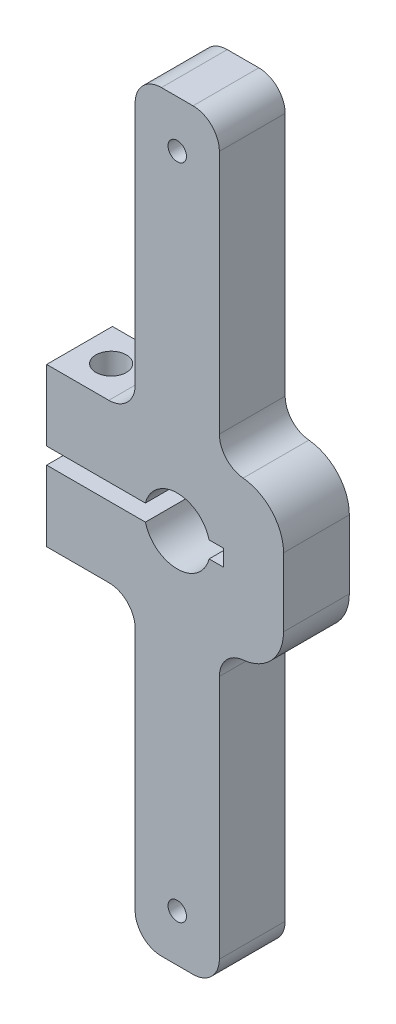
from build123d import *

# Parameters (mm, degrees)
EXTRUDE1_DEPTH              = 6.35
SKETCH2_W                   = 17.047492734
SKETCH2_H                   = 1.5875
EXTRUDE2_DEPTH              = 24.670955704
SKETCH4_R                   = 3.175
EXTRUDE4_DEPTH              = 24.670955704
FILLET2_R                   = 4.318
F_32_0_116_DIAMETER_HOLE1_D = 2.9464
EXTRUDE8_DEPTH              = 28.6766
FILLET1_R                   = 2.54


with BuildPart() as part:
    # Sketch1 → Extrude1 (new body)
    with BuildSketch(Plane.XY):
        Polygon((-21.492492734, 7.62), (-6.252492734, 7.62), (1.367507266, 7.62), (1.367507266, 0), (1.367507266, -7.62), (-6.252492734, -7.62), (-21.492492734, -7.62), align=None)
    extrude(amount=EXTRUDE1_DEPTH)

    # Sketch2 → Extrude2 (cut, through all)
    with BuildSketch(Plane.XY.offset(6.35)):
        with Locations((-12.968746367, 0)):
            Rectangle(SKETCH2_W, SKETCH2_H)
    extrude(amount=-EXTRUDE2_DEPTH, mode=Mode.SUBTRACT)

    # Sketch4 → Extrude4 (cut, through all)
    with BuildSketch(Plane.XY.offset(6.35)):
        with Locations((-8.89, 0)):
            Circle(SKETCH4_R)
    extrude(amount=-EXTRUDE4_DEPTH, mode=Mode.SUBTRACT)

    # Fillet2
    fillet2_edges = [part.edges().sort_by_distance(p)[0] for p in [
        (1.367507266, -7.62, 3.175),
        (1.367507266, 7.62, 3.175),
    ]]
    fillet(fillet2_edges, radius=FILLET2_R)

    # #32 (0.116) Diameter Hole1 (through all)
    with Locations(Plane(origin=(-18.444492734, -7.62, 3.175), x_dir=(0, 0, -1), z_dir=(0, -1, 0))):
        with Locations((0, 0)):
            Hole(F_32_0_116_DIAMETER_HOLE1_D / 2)

    # Sketch21 → Extrude8 (add)
    with BuildSketch(Plane(origin=(0, 7.62, 0), x_dir=(1, 0, 0), z_dir=(0, 1, 0))):
        Polygon((-8.89, 0), (-4.826, 0), (-4.826, -6.35), (-12.954, -6.35), (-12.954, 0), align=None)
    extrude8 = extrude(amount=EXTRUDE8_DEPTH)

    # Sketch27 → #50 (0.07) Diameter Hole1 (revolve, cut)
    with BuildSketch(Plane(origin=(-8.89, 31.75, 0), x_dir=(0, 1, 0), z_dir=(1, 0, 0))):
        Polygon((0, 0), (0, 6.88416509), (0.889, 6.35), (0.889, 0), align=None)
    f_50_0_07_diameter_hole1 = revolve(axis=Axis((-8.89, 31.75, -6.35), (0, 0, 1)), mode=Mode.SUBTRACT)

    # Mirror2: Extrude8, #50 (0.07) Diameter Hole1 across plane
    add(extrude8.mirror(Plane.ZX))
    add(f_50_0_07_diameter_hole1.mirror(Plane.ZX), mode=Mode.SUBTRACT)

    # Fillet1
    fillet1_edges = [part.edges().sort_by_distance(p)[0] for p in [
        (-12.954, 7.62, 3.175),
        (-4.826, 7.62, 3.175),
        (-12.954, 36.2966, 3.175),
        (-4.826, 36.2966, 3.175),
        (-12.954, -36.2966, 3.175),
        (-12.954, -7.62, 3.175),
        (-4.826, -7.62, 3.175),
        (-4.826, -36.2966, 3.175),
    ]]
    fillet(fillet1_edges, radius=FILLET1_R)


solid = part.part
